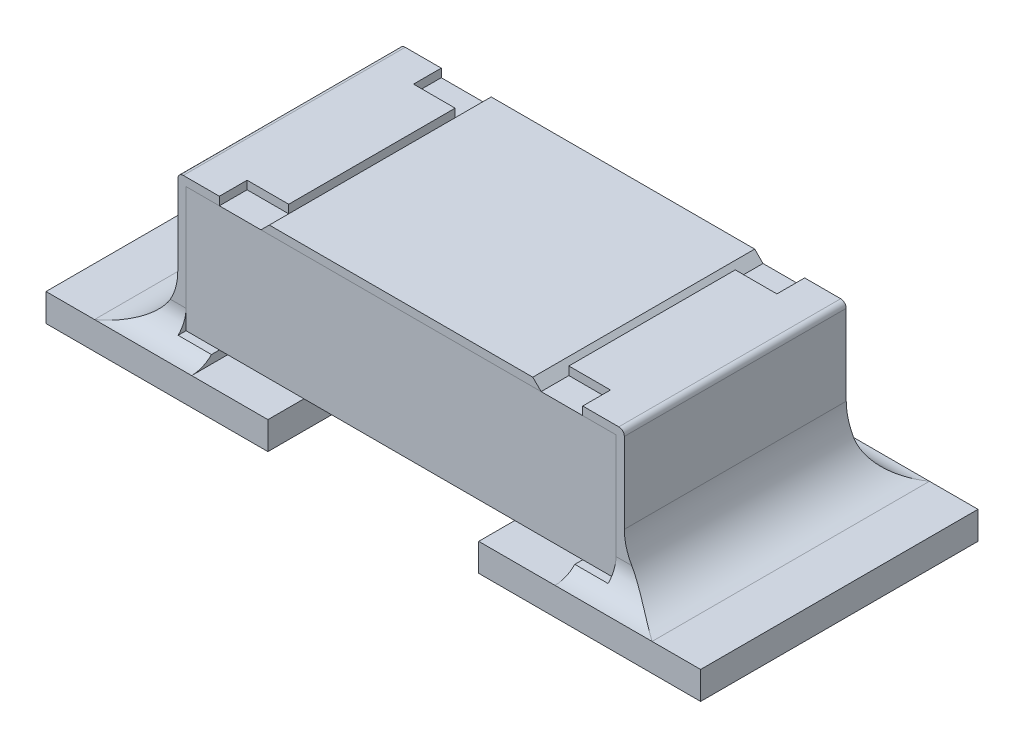
from build123d import *

# Parameters (mm, degrees)
SKETCH1_W             = 0.8
SKETCH1_H             = 0.45
BOSS_EXTRUDE1_DEPTH   = 1.55
BOSS_EXTRUDE2_DEPTH   = 0.8
BOSS_EXTRUDE2_2_DEPTH = 0.8
FILLET1_R             = 0.02
FILLET2_R             = 0.02
SKETCH3_W             = 0.15
SKETCH3_H             = 0.1
CUT_EXTRUDE1_DEPTH    = 2.707776332
BOSS_EXTRUDE3_DEPTH   = 0.8
SKETCH5_W             = 0.8
SKETCH5_H             = 1
BOSS_EXTRUDE4_DEPTH   = 0.1
FILLET3_R             = 0.2
FILLET4_R             = 0.2
FILLET5_START         = -0.087971281
FILLET5_DEPTH         = 0.087971281
FILLET5_START_2       = -0.2300001
FILLET5_2_DEPTH       = 0.142028819
FILLET5_START_3       = -0.0299999
FILLET5_3_DEPTH       = 0.1499999
FILLET5_START_4       = -2
FILLET5_4_OUTLINE_W   = 0.12
FILLET5_4_OUTLINE_H   = 0.07
FILLET5_4_DEPTH       = 3
FILLET6_START         = 1.43
FILLET6_DEPTH         = 0.209188627
FILLET6_START_2       = 1.55
FILLET6_2_DEPTH       = 0.0299999
FILLET6_START_3       = -0.5
FILLET6_3_DEPTH       = 1
FILLET6_START_4       = -0.3
FILLET6_4_OUTLINE_W   = 0.359188627
FILLET6_4_OUTLINE_H   = 0.03
FILLET6_4_OUTLINE_W_2 = 0.15
FILLET6_4_DEPTH       = 0.6
FILLET6_5_OUTLINE_W   = 0.209188627
FILLET6_5_OUTLINE_H   = 0.03
FILLET6_5_DEPTH       = 0.9
FILLET6_6_DEPTH       = 0.35


with BuildPart() as part:
    # Sketch1 → Boss-Extrude1 (new body)
    with BuildSketch(Plane(origin=(0, 0, 0), x_dir=(0, 0, -1), z_dir=(1, 0, 0))):
        with Locations((0, 0.355)):
            Rectangle(SKETCH1_W, SKETCH1_H)
    extrude(amount=BOSS_EXTRUDE1_DEPTH)


with BuildPart() as body_2:
    # Sketch2 → Boss-Extrude2 (new body)
    with BuildSketch(Plane.XY.offset(0.4)):
        Polygon((0.27, 0.58), (0, 0.58), (0, 0.13), (0.27, 0.13), (0.27, 0.1), (-0.03, 0.1), (-0.03, 0.61), (0.27, 0.61), align=None)
    extrude(amount=-BOSS_EXTRUDE2_DEPTH)

    # Fillet2
    fillet2_edges = [body_2.edges().sort_by_distance(p)[0] for p in [
        (-0.03, 0.61, 0),
    ]]
    fillet(fillet2_edges, radius=FILLET2_R)


with BuildPart() as body_3:
    # Sketch2 → Boss-Extrude2 2 (new body)
    with BuildSketch(Plane.XY.offset(0.4)):
        Polygon((1.28, 0.13), (1.28, 0.1), (1.58, 0.1), (1.58, 0.61), (1.28, 0.61), (1.28, 0.58), (1.55, 0.58), (1.55, 0.13), align=None)
    extrude(amount=-BOSS_EXTRUDE2_2_DEPTH)

    # Fillet1
    fillet1_edges = [body_3.edges().sort_by_distance(p)[0] for p in [
        (1.58, 0.61, 0),
    ]]
    fillet(fillet1_edges, radius=FILLET1_R)


with BuildPart() as cut_extrude1_tool:
    # Sketch3 → Cut-Extrude1 (new, through all)
    with BuildSketch(Plane(origin=(0, 0.61, 0), x_dir=(1, 0, 0), z_dir=(0, 1, 0))):
        with Locations((0.195, 0.35)):
            Rectangle(SKETCH3_W, SKETCH3_H)
        with Locations((1.355, 0.35)):
            Rectangle(SKETCH3_W, SKETCH3_H)
        with Locations((1.355, -0.35)):
            Rectangle(SKETCH3_W, SKETCH3_H)
        with Locations((0.195, -0.35)):
            Rectangle(SKETCH3_W, SKETCH3_H)
    extrude(amount=-CUT_EXTRUDE1_DEPTH)


with BuildPart() as body_2_1:
    add(body_2.part)

    # Cut-Extrude1: cut by cut_extrude1_tool
    add(cut_extrude1_tool.part, mode=Mode.SUBTRACT)



with BuildPart() as body_3_1:
    add(body_3.part)

    # Cut-Extrude1: cut by cut_extrude1_tool
    add(cut_extrude1_tool.part, mode=Mode.SUBTRACT)


with BuildPart() as body_4:
    # Sketch4 → Boss-Extrude3 (new body)
    with BuildSketch(Plane.XY.offset(0.4)):
        Polygon((0.27, 0.58), (1.28, 0.58), (1.25, 0.61), (0.3, 0.61), align=None)
    extrude(amount=-BOSS_EXTRUDE3_DEPTH)


with BuildPart() as body_2_2:
    add(body_2_1.part)

    add(body_3_1.part)  # Boss-Extrude4 merges body 3
    # Sketch5 → Boss-Extrude4 (add)
    with BuildSketch(Plane.XZ.offset(-0.1)):
        with Locations((-0.005, 0)):
            Rectangle(SKETCH5_W, SKETCH5_H)
        with Locations((1.555, 0)):
            Rectangle(SKETCH5_W, SKETCH5_H)
    extrude(amount=BOSS_EXTRUDE4_DEPTH)

    # Fillet3
    fillet3_edges = [body_2_2.edges().sort_by_distance(p)[0] for p in [
        (-0.03, 0.1, 0),
    ]]
    fillet(fillet3_edges, radius=FILLET3_R)

    # Fillet4
    fillet4_edges = [body_2_2.edges().sort_by_distance(p)[0] for p in [
        (1.58, 0.1, 0),
    ]]
    fillet(fillet4_edges, radius=FILLET4_R)

    # Fillet5: read off the stored shape, not the designer's step
    # Fillet5 outline → Fillet5 (add)
    with BuildSketch(Plane.YZ.offset(FILLET5_START)):
        with BuildLine():
            Line((0.1, 0.5), (0.1, 0.4))
            Line((0.1, 0.4), (0.2, 0.4))
            ThreePointArc((0.2, 0.4), (0.129289322, 0.429289322), (0.1, 0.5))
        make_face()
        with BuildLine():
            ThreePointArc((0.1, -0.5), (0.129289322, -0.429289322), (0.2, -0.4))
            Line((0.2, -0.4), (0.1, -0.4))
            Line((0.1, -0.4), (0.1, -0.5))
        make_face()
    extrude(amount=FILLET5_DEPTH)

    # Fillet5 2 outline → Fillet5 2 (add)
    with BuildSketch(Plane.YZ.offset(FILLET5_START_2)):
        with BuildLine():
            Line((0.1, 0.5), (0.1, 0.4))
            Line((0.1, 0.4), (0.2, 0.4))
            ThreePointArc((0.2, 0.4), (0.129289322, 0.429289322), (0.1, 0.5))
        make_face()
        with BuildLine():
            ThreePointArc((0.1, -0.5), (0.129289322, -0.429289322), (0.2, -0.4))
            Line((0.2, -0.4), (0.1, -0.4))
            Line((0.1, -0.4), (0.1, -0.5))
        make_face()
    extrude(amount=FILLET5_2_DEPTH)

    # Fillet5 3 outline → Fillet5 3 (add)
    with BuildSketch(Plane.YZ.offset(FILLET5_START_3)):
        with BuildLine():
            Line((0.1, 0.5), (0.1, 0.4))
            Line((0.1, 0.4), (0.2, 0.4))
            ThreePointArc((0.2, 0.4), (0.129289322, 0.429289322), (0.1, 0.5))
        make_face()
        with BuildLine():
            ThreePointArc((0.1, -0.5), (0.129289322, -0.429289322), (0.2, -0.4))
            Line((0.2, -0.4), (0.1, -0.4))
            Line((0.1, -0.4), (0.1, -0.5))
        make_face()
    extrude(amount=FILLET5_3_DEPTH)

    # Fillet5 4 outline → Fillet5 4 (cut)
    with BuildSketch(Plane.XY.offset(FILLET5_START_4)):
        with Locations((0.06, 0.165)):
            Rectangle(FILLET5_4_OUTLINE_W, FILLET5_4_OUTLINE_H)
        with BuildLine():
            Line((-0.2300001, 0.2), (-0.23000005, 0.1))
            ThreePointArc((-0.23000005, 0.1), (-0.130000022, 0.126794907), (-0.056794919, 0.2))
            Line((-0.056794919, 0.2), (-0.2300001, 0.2))
        make_face()
    extrude(amount=FILLET5_4_DEPTH, mode=Mode.SUBTRACT)

    # Fillet6: read off the stored shape, not the designer's step
    # Fillet6 outline → Fillet6 (add)
    with BuildSketch(Plane.YZ.offset(FILLET6_START)):
        with BuildLine():
            ThreePointArc((0.1, -0.5), (0.107804555, -0.461270167), (0.13, -0.428585716))
            Line((0.13, -0.428585716), (0.13, -0.4))
            Line((0.13, -0.4), (0.1, -0.4))
            Line((0.1, -0.4), (0.1, -0.5))
        make_face()
        with BuildLine():
            Line((0.1, 0.4), (0.13, 0.4))
            Line((0.13, 0.4), (0.13, 0.428585716))
            ThreePointArc((0.13, 0.428585716), (0.107804555, 0.461270167), (0.1, 0.5))
            Line((0.1, 0.5), (0.1, 0.4))
        make_face()
    extrude(amount=FILLET6_DEPTH)

    # Fillet6 2 outline → Fillet6 2 (add)
    with BuildSketch(Plane.YZ.offset(FILLET6_START_2)):
        with BuildLine():
            ThreePointArc((0.13, -0.428585716), (0.162194104, -0.407421848), (0.2, -0.4))
            Line((0.2, -0.4), (0.13, -0.4))
            Line((0.13, -0.4), (0.13, -0.428585716))
        make_face()
        with BuildLine():
            Line((0.13, 0.428585716), (0.13, 0.4))
            Line((0.13, 0.4), (0.2, 0.4))
            ThreePointArc((0.2, 0.4), (0.162194104, 0.407421848), (0.13, 0.428585716))
        make_face()
    extrude(amount=FILLET6_2_DEPTH)

    # Fillet6 3 outline → Fillet6 3 (add)
    with BuildSketch(Plane.XY.offset(FILLET6_START_3)):
        with BuildLine():
            Line((1.639188627, 0.1), (1.155, 0.1))
            Line((1.155, 0.1), (1.155, 0))
            Line((1.155, 0), (1.955, 0))
            Line((1.955, 0), (1.955, 0.1))
            Line((1.955, 0.1), (1.78, 0.1))
            ThreePointArc((1.78, 0.1), (1.638578644, 0.158578644), (1.58, 0.3))
            Line((1.58, 0.3), (1.58, 0.59))
            ThreePointArc((1.58, 0.59), (1.574142136, 0.604142136), (1.56, 0.61))
            Line((1.56, 0.61), (1.43, 0.61))
            Line((1.43, 0.61), (1.43, 0.58))
            Line((1.43, 0.58), (1.55, 0.58))
            Line((1.55, 0.58), (1.55, 0.13))
            Line((1.55, 0.13), (1.5799999, 0.13))
            Line((1.5799999, 0.13), (1.639188627, 0.13))
            Line((1.639188627, 0.13), (1.639188627, 0.1))
        make_face()
    extrude(amount=FILLET6_3_DEPTH)

    # Fillet6 4 outline → Fillet6 4 (add)
    with BuildSketch(Plane.XY.offset(FILLET6_START_4)):
        with Locations((1.459594314, 0.115)):
            Rectangle(FILLET6_4_OUTLINE_W, FILLET6_4_OUTLINE_H)
        with Locations((1.355, 0.595)):
            Rectangle(FILLET6_4_OUTLINE_W_2, FILLET6_4_OUTLINE_H)
    extrude(amount=FILLET6_4_DEPTH)

    # Fillet6 5 outline → Fillet6 5 (add)
    with BuildSketch(Plane.XY.offset(FILLET6_START_3)):
        with Locations((1.534594313, 0.115)):
            Rectangle(FILLET6_5_OUTLINE_W, FILLET6_5_OUTLINE_H)
    extrude(amount=FILLET6_5_DEPTH)

    # Fillet6 6 outline → Fillet6 6 (cut)
    with BuildSketch(Plane.YZ.offset(FILLET6_START)):
        with BuildLine():
            Line((0.2, 0.4), (0.61, 0.4))
            Line((0.61, 0.4), (0.61, 0.5))
            Line((0.61, 0.5), (0.1, 0.5))
            ThreePointArc((0.1, 0.5), (0.129289322, 0.429289322), (0.2, 0.4))
        make_face()
        with BuildLine():
            Line((0.1, -0.5), (0.61, -0.5))
            Line((0.61, -0.5), (0.61, -0.4))
            Line((0.61, -0.4), (0.2, -0.4))
            ThreePointArc((0.2, -0.4), (0.129289322, -0.429289322), (0.1, -0.5))
        make_face()
    extrude(amount=FILLET6_6_DEPTH, mode=Mode.SUBTRACT)


solid = Compound([part.part, body_4.part, body_2_2.part])
